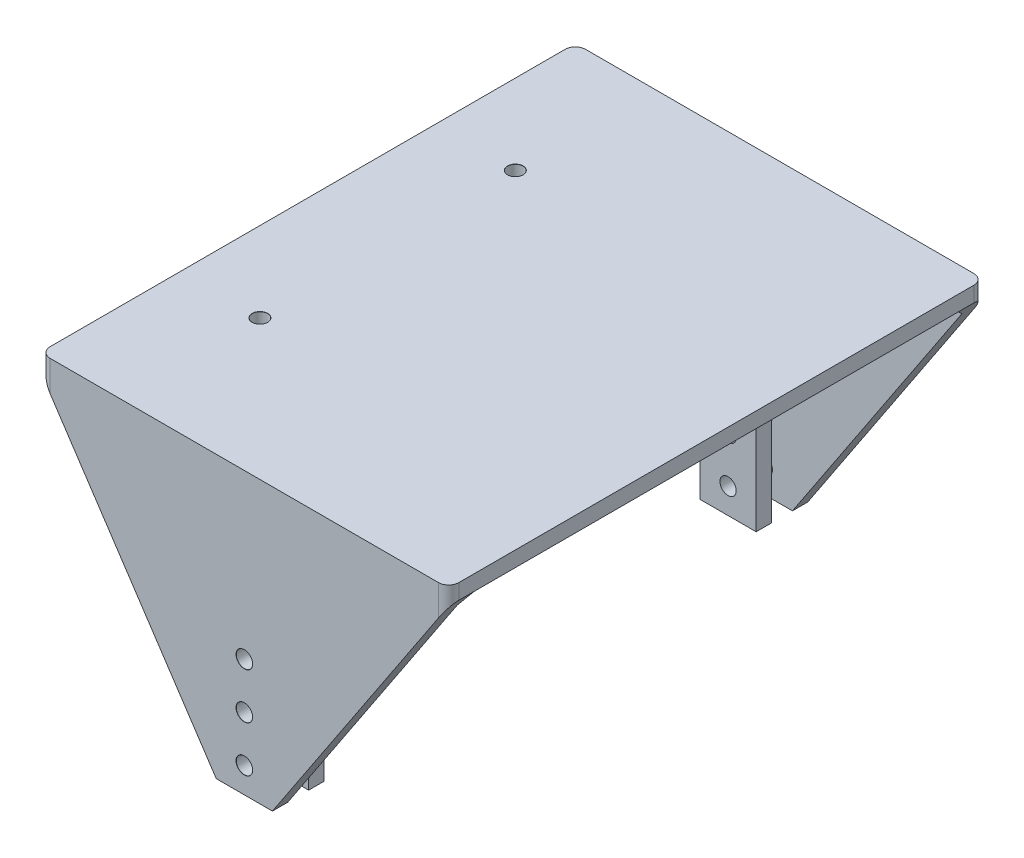
from build123d import *

# Parameters (mm, degrees)
SKETCH1_W                       = 80
SKETCH1_H                       = 98.8
BOSS_EXTRUDE1_DEPTH             = 3
BOSS_EXTRUDE2_DEPTH             = 3
CHAMFER2_SIZE                   = 2
FILLET1_R                       = 2
SKETCH4_W                       = 11
SKETCH4_H                       = 3
BOSS_EXTRUDE3_DEPTH             = 4.1
SKETCH6_W                       = 11
SKETCH6_H                       = 32.1
BOSS_EXTRUDE4_DEPTH             = 3
CHAMFER3_SIZE                   = 2
F_3_0MM_DOWEL_HOLE1_D           = 3.2
F_3_0MM_DOWEL_HOLE1_CSINK_D     = 3.25
F_3_0MM_DOWEL_HOLE1_CSINK_ANGLE = 90
F_3_0MM_DOWEL_HOLE2_D           = 3
F_3_0MM_DOWEL_HOLE2_DEPTH       = 20
F_3_0MM_DOWEL_HOLE2_CSINK_D     = 3.05
F_3_0MM_DOWEL_HOLE2_CSINK_ANGLE = 90
F_3_0MM_DOWEL_HOLE2_TIP         = 0.901290929


with BuildPart() as part:
    # Sketch1 → Boss-Extrude1 (new body)
    with BuildSketch(Plane(origin=(0, 0, 0), x_dir=(1, 0, 0), z_dir=(0, 1, 0))):
        Rectangle(SKETCH1_W, SKETCH1_H)
    extrude(amount=BOSS_EXTRUDE1_DEPTH)

    # Sketch3 → Boss-Extrude2 (add)
    with BuildSketch(Plane.XY.offset(49.4)):
        Polygon((-40, 0), (-40, 3), (40, 3), (40, 0), (5.5, -52), (-5.5, -52), align=None)
    boss_extrude2 = extrude(amount=BOSS_EXTRUDE2_DEPTH)

    # Mirror1: Boss-Extrude2 across plane
    add(boss_extrude2.mirror(Plane.XY))

    # Chamfer2
    chamfer2_edges = [part.edges().sort_by_distance(p)[0] for p in [
        (0, 0, -49.4),
        (0, 0, 49.4),
    ]]
    chamfer(chamfer2_edges, length=CHAMFER2_SIZE)

    # Fillet1
    fillet1_edges = [part.edges().sort_by_distance(p)[0] for p in [
        (-40, 1.5, 52.4),
        (-40, 1.5, -52.4),
        (40, 1.5, -52.4),
        (40, 1.5, 52.4),
    ]]
    fillet(fillet1_edges, radius=FILLET1_R)

    # Sketch4 → Boss-Extrude3 (add)
    with BuildSketch(Plane(origin=(0, 0, 49.4), x_dir=(-1, 0, 0), z_dir=(0, 0, -1))):
        with Locations((0, -21.4)):
            Rectangle(SKETCH4_W, SKETCH4_H)
    boss_extrude3 = extrude(amount=BOSS_EXTRUDE3_DEPTH)

    # Sketch6 → Boss-Extrude4 (add)
    with BuildSketch(Plane(origin=(0, 0, 45.3), x_dir=(-1, 0, 0), z_dir=(0, 0, -1))):
        with Locations((0, -35.95)):
            Rectangle(SKETCH6_W, SKETCH6_H)
    boss_extrude4 = extrude(amount=BOSS_EXTRUDE4_DEPTH)

    # Mirror4: Boss-Extrude3, Boss-Extrude4 across plane
    add(boss_extrude3.mirror(Plane.XY))
    add(boss_extrude4.mirror(Plane.XY))

    # Chamfer3
    chamfer3_edges = [part.edges().sort_by_distance(p)[0] for p in [
        (0, -19.9, 49.4),
        (0, -19.9, -49.4),
    ]]
    chamfer(chamfer3_edges, length=CHAMFER3_SIZE)

    # Ø3.0mm Dowel Hole1 (through all)
    with Locations(Plane.XY.offset(52.4)):
        with Locations((0, -47), (0, -38), (0, -29)):
            CounterSinkHole(F_3_0MM_DOWEL_HOLE1_D / 2, F_3_0MM_DOWEL_HOLE1_CSINK_D / 2, counter_sink_angle=F_3_0MM_DOWEL_HOLE1_CSINK_ANGLE)

    # Ø3.0mm Dowel Hole2
    with Locations(Plane(origin=(0, 3, 0), x_dir=(1, 0, 0), z_dir=(0, 1, 0))):
        with Locations((-24.35, 25), (-24.35, -25)):
            CounterSinkHole(F_3_0MM_DOWEL_HOLE2_D / 2, F_3_0MM_DOWEL_HOLE2_CSINK_D / 2, depth=F_3_0MM_DOWEL_HOLE2_DEPTH, counter_sink_angle=F_3_0MM_DOWEL_HOLE2_CSINK_ANGLE)
            with Locations((0, 0, -(F_3_0MM_DOWEL_HOLE2_DEPTH + F_3_0MM_DOWEL_HOLE2_TIP / 2))):  # 118° drill point
                Cone(0, F_3_0MM_DOWEL_HOLE2_D / 2, F_3_0MM_DOWEL_HOLE2_TIP, mode=Mode.SUBTRACT)


solid = part.part
